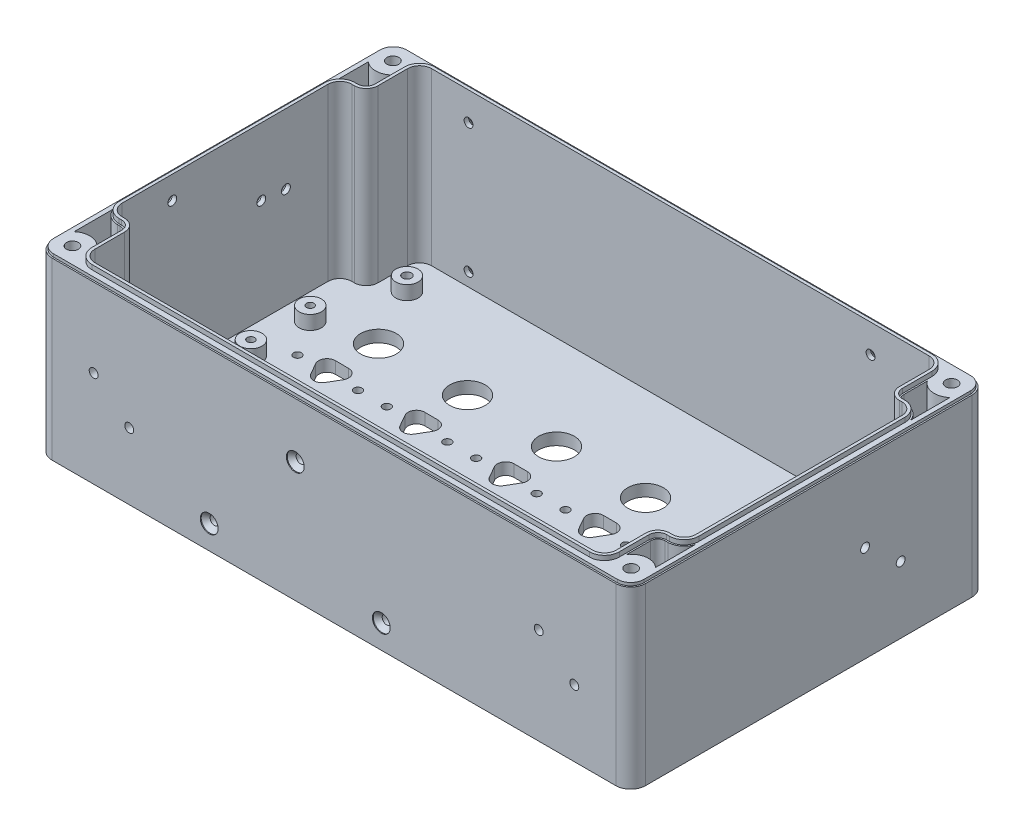
from build123d import *

# Parameters (mm, degrees)
SKETCH1_W                                         = 200
SKETCH1_H                                         = 120
BOSS_EXTRUDE1_DEPTH                               = 60
FILLET1_R                                         = 5
SKETCH2_W                                         = 175.7
SKETCH2_H                                         = 18
SKETCH2_H_2                                       = 77.4
SKETCH2_W_2                                       = 8.85
SKETCH2_R                                         = 2
CUT_EXTRUDE1_DEPTH                                = 56
FILLET2_R                                         = 4
BOSS_EXTRUDE2_DEPTH                               = 1.55
CUT_EXTRUDE2_REACH                                = 132.046
SKETCH4_R                                         = 2
SKETCH5_R                                         = 3.45
CUT_EXTRUDE3_DEPTH                                = 52
CUT_EXTRUDE4_DEPTH                                = 56
CUT_EXTRUDE5_REACH                                = 133.865
SKETCH7_R                                         = 2.225
SKETCH8_R                                         = 3.75
SKETCH8_R_2                                       = 1.5
SKETCH8_R_3                                       = 1.25
BOSS_EXTRUDE3_DEPTH                               = 4.7
CUT_EXTRUDE6_DEPTH                                = 1
CUT_EXTRUDE7_START                                = -4.7
SKETCH10_R                                        = 3.75
CUT_EXTRUDE7_DEPTH                                = 4.7
CUT_EXTRUDE8_REACH                                = 169.894
SKETCH11_R                                        = 1.5
CSK_FOR_M3_FLAT_HEAD_MACHINE_SCREW1_AT_2_COUNT    = 2
CSK_FOR_M3_FLAT_HEAD_MACHINE_SCREW1_AT_2_PITCH    = 43.49999936
CSK_FOR_M3_FLAT_HEAD_MACHINE_SCREW1_AT_3_COUNT    = 2
CSK_FOR_M3_FLAT_HEAD_MACHINE_SCREW1_AT_3_PITCH    = 142.311279088
CSK_FOR_M3_FLAT_HEAD_MACHINE_SCREW1_AT_4_COUNT    = 2
CSK_FOR_M3_FLAT_HEAD_MACHINE_SCREW1_AT_4_PITCH    = 135.50000078
CUT_EXTRUDE9_REACH                                = 219.689
SKETCH15_R                                        = 1.5
CSK_FOR_M3_FLAT_HEAD_MACHINE_SCREW2_AT_2_COUNT    = 2
CSK_FOR_M3_FLAT_HEAD_MACHINE_SCREW2_AT_2_PITCH    = 8.338465087
CSK_FOR_M3_FLAT_HEAD_MACHINE_SCREW2_AT_3_COUNT    = 2
CSK_FOR_M3_FLAT_HEAD_MACHINE_SCREW2_AT_3_PITCH    = 41.431027021
CSK_FOR_M3_FLAT_HEAD_MACHINE_SCREW2_AT_4_COUNT    = 2
CSK_FOR_M3_FLAT_HEAD_MACHINE_SCREW2_AT_4_PITCH    = 46.065171225
CUT_EXTRUDE10_REACH                               = 169.894
SKETCH20_R                                        = 1.5
CUT_EXTRUDE11_REACH                               = 219.689
SKETCH21_R                                        = 1.5
CUT_EXTRUDE12_REACH                               = 133.865
SKETCH23_R                                        = 6
SKETCH23_R_2                                      = 1.35
FILLET3_R                                         = 1
CUT_EXTRUDE13_START                               = -4
CUT_EXTRUDE13_OUTLINE_R                           = 1.35
CUT_EXTRUDE13_DEPTH                               = 4
CUT_EXTRUDE15_REACH                               = 169.894
SKETCH28_R                                        = 1.5
CUT_EXTRUDE16_REACH                               = 133.865
SKETCH31_R                                        = 1.6
CSK_FOR_M2_5_FLAT_HEAD_MACHINE_SCREW1_AT_COUNT    = 2
CSK_FOR_M2_5_FLAT_HEAD_MACHINE_SCREW1_AT_PITCH    = 20.5
CSK_FOR_M2_5_FLAT_HEAD_MACHINE_SCREW_2_COUNT      = 2
CSK_FOR_M2_5_FLAT_HEAD_MACHINE_SCREW_2_PITCH      = 30.111126102
CSK_FOR_M2_5_FLAT_HEAD_MACHINE_SCREW_3_COUNT      = 2
CSK_FOR_M2_5_FLAT_HEAD_MACHINE_SCREW_3_PITCH      = 50.610915095
CSK_FOR_M2_5_FLAT_HEAD_MACHINE_SCREW_4_COUNT      = 2
CSK_FOR_M2_5_FLAT_HEAD_MACHINE_SCREW_4_PITCH      = 60.222252203
CSK_FOR_M2_5_FLAT_HEAD_MACHINE_SCREW_5_COUNT      = 2
CSK_FOR_M2_5_FLAT_HEAD_MACHINE_SCREW_5_PITCH      = 80.72198761
CSK_FOR_M2_5_FLAT_HEAD_MACHINE_SCREW_6_COUNT      = 2
CSK_FOR_M2_5_FLAT_HEAD_MACHINE_SCREW_6_PITCH      = 90.333378305
CSK_FOR_M2_5_FLAT_HEAD_MACHINE_SCREW_7_COUNT      = 2
CSK_FOR_M2_5_FLAT_HEAD_MACHINE_SCREW_7_PITCH      = 110.833089242
CSK_FOR_M2_5_FLAT_HEAD_MACHINE_SCREW_8_COUNT      = 2
CSK_FOR_M2_5_FLAT_HEAD_MACHINE_SCREW_8_PITCH      = 126.831152763
CSK_FOR_M2_5_FLAT_HEAD_MACHINE_SCREW_9_COUNT      = 2
CSK_FOR_M2_5_FLAT_HEAD_MACHINE_SCREW_9_PITCH      = 125.355382157
CUT_EXTRUDE17_REACH                               = 133.865
SKETCH34_R                                        = 1.6
SKETCH34_R_2                                      = 14
CSK_FOR_M3_FLAT_HEAD_MACHINE_SCREW3_AT_2_COUNT    = 2
CSK_FOR_M3_FLAT_HEAD_MACHINE_SCREW3_AT_2_PITCH    = 43.55743335
CSK_FOR_M3_FLAT_HEAD_MACHINE_SCREW3_AT_3_COUNT    = 2
CSK_FOR_M3_FLAT_HEAD_MACHINE_SCREW3_AT_3_PITCH    = 58
CSK_FOR_M3_FLAT_HEAD_MACHINE_SCREW4_AT_2_COUNT    = 2
CSK_FOR_M3_FLAT_HEAD_MACHINE_SCREW4_AT_2_PITCH    = 26
CSK_FOR_M3_FLAT_HEAD_MACHINE_SCREW4_AT_3_COUNT    = 2
CSK_FOR_M3_FLAT_HEAD_MACHINE_SCREW4_AT_3_PITCH    = 66
CSK_FOR_M3_FLAT_HEAD_MACHINE_SCREW4_AT_4_COUNT    = 2
CSK_FOR_M3_FLAT_HEAD_MACHINE_SCREW4_AT_4_PITCH    = 70.936591404
CUT_EXTRUDE18_REACH                               = 133.865
SKETCH35_R                                        = 1.35
CSK_FOR_M2_5_FLAT_HEAD_MACHINE_SCREW2_D           = 2.5
CSK_FOR_M2_5_FLAT_HEAD_MACHINE_SCREW2_DEPTH       = 3.999
CSK_FOR_M2_5_FLAT_HEAD_MACHINE_SCREW2_CSINK_D     = 5
CSK_FOR_M2_5_FLAT_HEAD_MACHINE_SCREW2_CSINK_ANGLE = 90
CSK_FOR_M2_5_FLAT_HEAD_MACHINE_SCREW2_TIP         = 0.751075774


# Read off the part's stored shape, not the designer's step: Cut-Extrude13
with BuildPart() as part:
    # Sketch1 → Boss-Extrude1 (new body)
    with BuildSketch(Plane(origin=(0, 0, 0), x_dir=(1, 0, 0), z_dir=(0, 1, 0))):
        Rectangle(SKETCH1_W, SKETCH1_H)
    extrude(amount=BOSS_EXTRUDE1_DEPTH)

    # Fillet1
    fillet1_edges = [part.edges().sort_by_distance(p)[0] for p in [
        (100, 30, 60),
        (-100, 30, 60),
        (-100, 30, -60),
        (100, 30, -60),
    ]]
    fillet(fillet1_edges, radius=FILLET1_R)

    # Sketch2 → Cut-Extrude1 (cut)
    with BuildSketch(Plane(origin=(0, 60, 0), x_dir=(1, 0, 0), z_dir=(0, 1, 0))):
        with Locations((0, 47.7)):
            Rectangle(SKETCH2_W, SKETCH2_H)
        Rectangle(SKETCH2_W, SKETCH2_H_2)
        with Locations((0, -47.7)):
            Rectangle(SKETCH2_W, SKETCH2_H)
        with Locations((-92.275, 0)):
            Rectangle(SKETCH2_W_2, SKETCH2_H_2)
        with Locations((92.275, 0)):
            Rectangle(SKETCH2_W_2, SKETCH2_H_2)
        with Locations(Location((-94.15, 54, 0), (0, 0, 270))):
            Circle(SKETCH2_R)
        with Locations(Location((-94.15, -54, 0), (0, 0, 270))):
            Circle(SKETCH2_R)
        with Locations(Location((94.15, 54, 0), (0, 0, 270))):
            Circle(SKETCH2_R)
        with Locations(Location((94.15, -54, 0), (0, 0, 270))):
            Circle(SKETCH2_R)
    extrude(amount=-CUT_EXTRUDE1_DEPTH, mode=Mode.SUBTRACT)

    # Fillet2
    fillet2_edges = [part.edges().sort_by_distance(p)[0] for p in [
        (-87.85, 32, -38.7),
        (-87.85, 32, -56.7),
        (87.85, 32, -56.7),
        (87.85, 32, -38.7),
        (96.7, 32, -38.7),
        (96.7, 32, 38.7),
        (87.85, 32, 38.7),
        (87.85, 32, 56.7),
        (-87.85, 32, 56.7),
        (-87.85, 32, 38.7),
        (-96.7, 32, 38.7),
        (-96.7, 32, -38.7),
    ]]
    fillet(fillet2_edges, radius=FILLET2_R)

    # Sketch3 → Boss-Extrude2 (add)
    with BuildSketch(Plane(origin=(0, 60, 0), x_dir=(1, 0, 0), z_dir=(0, 1, 0))):
        with BuildLine():
            Line((83.85, 57.7), (-83.85, 57.7))
            ThreePointArc((-83.85, 57.7), (-87.385533906, 56.235533906), (-88.85, 52.7))
            Line((-88.85, 52.7), (-88.85, 42.7))
            ThreePointArc((-88.85, 42.7), (-89.728679656, 40.578679656), (-91.85, 39.7))
            Line((-91.85, 39.7), (-92.7, 39.7))
            ThreePointArc((-92.7, 39.7), (-96.235533906, 38.235533906), (-97.7, 34.7))
            Line((-97.7, 34.7), (-97.7, -34.7))
            ThreePointArc((-97.7, -34.7), (-96.235533906, -38.235533906), (-92.7, -39.7))
            Line((-92.7, -39.7), (-91.85, -39.7))
            ThreePointArc((-91.85, -39.7), (-89.728679656, -40.578679656), (-88.85, -42.7))
            Line((-88.85, -42.7), (-88.85, -52.7))
            ThreePointArc((-88.85, -52.7), (-87.385533906, -56.235533906), (-83.85, -57.7))
            Line((-83.85, -57.7), (83.85, -57.7))
            ThreePointArc((83.85, -57.7), (87.385533906, -56.235533906), (88.85, -52.7))
            Line((88.85, -52.7), (88.85, -42.7))
            ThreePointArc((88.85, -42.7), (89.728679656, -40.578679656), (91.85, -39.7))
            Line((91.85, -39.7), (92.7, -39.7))
            ThreePointArc((92.7, -39.7), (96.235533906, -38.235533906), (97.7, -34.7))
            Line((97.7, -34.7), (97.7, 34.7))
            ThreePointArc((97.7, 34.7), (96.235533906, 38.235533906), (92.7, 39.7))
            Line((92.7, 39.7), (91.85, 39.7))
            ThreePointArc((91.85, 39.7), (89.728679656, 40.578679656), (88.85, 42.7))
            Line((88.85, 42.7), (88.85, 52.7))
            ThreePointArc((88.85, 52.7), (87.385533906, 56.235533906), (83.85, 57.7))
        make_face()
        with BuildLine():
            Line((87.85, 42.7), (87.85, 52.7))
            ThreePointArc((87.85, 52.7), (86.678427125, 55.528427125), (83.85, 56.7))
            Line((83.85, 56.7), (-83.85, 56.7))
            ThreePointArc((-83.85, 56.7), (-86.678427125, 55.528427125), (-87.85, 52.7))
            Line((-87.85, 52.7), (-87.85, 42.7))
            ThreePointArc((-87.85, 42.7), (-89.021572875, 39.871572875), (-91.85, 38.7))
            Line((-91.85, 38.7), (-92.7, 38.7))
            ThreePointArc((-92.7, 38.7), (-95.528427125, 37.528427125), (-96.7, 34.7))
            Line((-96.7, 34.7), (-96.7, -34.7))
            ThreePointArc((-96.7, -34.7), (-95.528427125, -37.528427125), (-92.7, -38.7))
            Line((-92.7, -38.7), (-91.85, -38.7))
            ThreePointArc((-91.85, -38.7), (-89.021572875, -39.871572875), (-87.85, -42.7))
            Line((-87.85, -42.7), (-87.85, -52.7))
            ThreePointArc((-87.85, -52.7), (-86.678427125, -55.528427125), (-83.85, -56.7))
            Line((-83.85, -56.7), (83.85, -56.7))
            ThreePointArc((83.85, -56.7), (86.678427125, -55.528427125), (87.85, -52.7))
            Line((87.85, -52.7), (87.85, -42.7))
            ThreePointArc((87.85, -42.7), (89.021572875, -39.871572875), (91.85, -38.7))
            Line((91.85, -38.7), (92.7, -38.7))
            ThreePointArc((92.7, -38.7), (95.528427125, -37.528427125), (96.7, -34.7))
            Line((96.7, -34.7), (96.7, 34.7))
            ThreePointArc((96.7, 34.7), (95.528427125, 37.528427125), (92.7, 38.7))
            Line((92.7, 38.7), (91.85, 38.7))
            ThreePointArc((91.85, 38.7), (89.021572875, 39.871572875), (87.85, 42.7))
        make_face(mode=Mode.SUBTRACT)
    extrude(amount=BOSS_EXTRUDE2_DEPTH)

    # Sketch4 → Cut-Extrude2 (cut, up to next)
    with BuildSketch(Plane(origin=(0, 4, 0), x_dir=(1, 0, 0), z_dir=(0, 1, 0)), mode=Mode.PRIVATE) as cut_extrude2_sk1:
        with Locations(Location((-94.15, 54, 0), (0, 0, 270))):
            Circle(SKETCH4_R)
    cut_extrude2_tool1 = extrude(cut_extrude2_sk1.sketch, amount=-CUT_EXTRUDE2_REACH, mode=Mode.PRIVATE) & part.part
    # Sketch4 → Cut-Extrude2 (cut, up to next)
    with BuildSketch(Plane(origin=(0, 4, 0), x_dir=(1, 0, 0), z_dir=(0, 1, 0)), mode=Mode.PRIVATE) as cut_extrude2_sk2:
        with Locations(Location((94.15, 54, 0), (0, 0, 270))):
            Circle(SKETCH4_R)
    cut_extrude2_tool2 = extrude(cut_extrude2_sk2.sketch, amount=-CUT_EXTRUDE2_REACH, mode=Mode.PRIVATE) & part.part
    # Sketch4 → Cut-Extrude2 (cut, up to next)
    with BuildSketch(Plane(origin=(0, 4, 0), x_dir=(1, 0, 0), z_dir=(0, 1, 0)), mode=Mode.PRIVATE) as cut_extrude2_sk3:
        with Locations(Location((-94.15, -54, 0), (0, 0, 270))):
            Circle(SKETCH4_R)
    cut_extrude2_tool3 = extrude(cut_extrude2_sk3.sketch, amount=-CUT_EXTRUDE2_REACH, mode=Mode.PRIVATE) & part.part
    # Sketch4 → Cut-Extrude2 (cut, up to next)
    with BuildSketch(Plane(origin=(0, 4, 0), x_dir=(1, 0, 0), z_dir=(0, 1, 0)), mode=Mode.PRIVATE) as cut_extrude2_sk4:
        with Locations(Location((94.15, -54, 0), (0, 0, 270))):
            Circle(SKETCH4_R)
    cut_extrude2_tool4 = extrude(cut_extrude2_sk4.sketch, amount=-CUT_EXTRUDE2_REACH, mode=Mode.PRIVATE) & part.part
    add(cut_extrude2_tool1.solids().sort_by_distance((-94.15, 4, -54))[0], mode=Mode.SUBTRACT)
    add(cut_extrude2_tool2.solids().sort_by_distance((94.15, 4, -54))[0], mode=Mode.SUBTRACT)
    add(cut_extrude2_tool3.solids().sort_by_distance((-94.15, 4, 54))[0], mode=Mode.SUBTRACT)
    add(cut_extrude2_tool4.solids().sort_by_distance((94.15, 4, 54))[0], mode=Mode.SUBTRACT)

    # Sketch5 → Cut-Extrude3 (cut)
    with BuildSketch(Plane.XZ):
        with Locations(Location((-94.15, 54, 0), (0, 0, 270))):
            Circle(SKETCH5_R)
        with Locations(Location((94.15, 54, 0), (0, 0, 270))):
            Circle(SKETCH5_R)
        with Locations(Location((94.15, -54, 0), (0, 0, 270))):
            Circle(SKETCH5_R)
        with Locations(Location((-94.15, -54, 0), (0, 0, 270))):
            Circle(SKETCH5_R)
    extrude(amount=-CUT_EXTRUDE3_DEPTH, mode=Mode.SUBTRACT)

    # Sketch6 → Cut-Extrude4 (cut)
    with BuildSketch(Plane(origin=(0, 60, 0), x_dir=(1, 0, 0), z_dir=(0, 1, 0))):
        with BuildLine():
            ThreePointArc((-89.35, 50.655975479), (-93.438101188, 48.193477798), (-98, 49.595456891))
            Line((-98, 49.595456891), (-98, 36.169693846))
            ThreePointArc((-98, 36.169693846), (-96.02916535, 39.077974198), (-92.7, 40.2))
            Line((-92.7, 40.2), (-91.85, 40.2))
            ThreePointArc((-91.85, 40.2), (-90.082233047, 40.932233047), (-89.35, 42.7))
            Line((-89.35, 42.7), (-89.35, 50.655975479))
        make_face()
        with BuildLine():
            Line((98, 36.169693846), (98, 49.595456891))
            ThreePointArc((98, 49.595456891), (93.438101188, 48.193477798), (89.35, 50.655975479))
            Line((89.35, 50.655975479), (89.35, 42.7))
            ThreePointArc((89.35, 42.7), (90.082233047, 40.932233047), (91.85, 40.2))
            Line((91.85, 40.2), (92.7, 40.2))
            ThreePointArc((92.7, 40.2), (96.02916535, 39.077974198), (98, 36.169693846))
        make_face()
        with BuildLine():
            Line((98, -49.595456891), (98, -36.169693846))
            ThreePointArc((98, -36.169693846), (96.02916535, -39.077974198), (92.7, -40.2))
            Line((92.7, -40.2), (91.85, -40.2))
            ThreePointArc((91.85, -40.2), (90.082233047, -40.932233047), (89.35, -42.7))
            Line((89.35, -42.7), (89.35, -50.655975479))
            ThreePointArc((89.35, -50.655975479), (93.438101188, -48.193477798), (98, -49.595456891))
        make_face()
        with BuildLine():
            ThreePointArc((-92.7, -40.2), (-96.02916535, -39.077974198), (-98, -36.169693846))
            Line((-98, -36.169693846), (-98, -49.595456891))
            ThreePointArc((-98, -49.595456891), (-93.438101188, -48.193477798), (-89.35, -50.655975479))
            Line((-89.35, -50.655975479), (-89.35, -42.7))
            ThreePointArc((-89.35, -42.7), (-90.082233047, -40.932233047), (-91.85, -40.2))
            Line((-91.85, -40.2), (-92.7, -40.2))
        make_face()
    extrude(amount=-CUT_EXTRUDE4_DEPTH, mode=Mode.SUBTRACT)

    # Sketch7 → Cut-Extrude5 (cut, up to next)
    with BuildSketch(Plane.XZ, mode=Mode.PRIVATE) as cut_extrude5_sk1:
        with Locations(Location((-94.15, 45, 0), (0, 0, 270))):
            Circle(SKETCH7_R)
    cut_extrude5_tool1 = extrude(cut_extrude5_sk1.sketch, amount=-CUT_EXTRUDE5_REACH, mode=Mode.PRIVATE) & part.part
    # Sketch7 → Cut-Extrude5 (cut, up to next)
    with BuildSketch(Plane.XZ, mode=Mode.PRIVATE) as cut_extrude5_sk2:
        with Locations(Location((94.15, 45, 0), (0, 0, 270))):
            Circle(SKETCH7_R)
    cut_extrude5_tool2 = extrude(cut_extrude5_sk2.sketch, amount=-CUT_EXTRUDE5_REACH, mode=Mode.PRIVATE) & part.part
    # Sketch7 → Cut-Extrude5 (cut, up to next)
    with BuildSketch(Plane.XZ, mode=Mode.PRIVATE) as cut_extrude5_sk3:
        with Locations(Location((94.15, -45, 0), (0, 0, 270))):
            Circle(SKETCH7_R)
    cut_extrude5_tool3 = extrude(cut_extrude5_sk3.sketch, amount=-CUT_EXTRUDE5_REACH, mode=Mode.PRIVATE) & part.part
    # Sketch7 → Cut-Extrude5 (cut, up to next)
    with BuildSketch(Plane.XZ, mode=Mode.PRIVATE) as cut_extrude5_sk4:
        with Locations(Location((-94.15, -45, 0), (0, 0, 270))):
            Circle(SKETCH7_R)
    cut_extrude5_tool4 = extrude(cut_extrude5_sk4.sketch, amount=-CUT_EXTRUDE5_REACH, mode=Mode.PRIVATE) & part.part
    add(cut_extrude5_tool1.solids().sort_by_distance((-94.15, 0, 45))[0], mode=Mode.SUBTRACT)
    add(cut_extrude5_tool2.solids().sort_by_distance((94.15, 0, 45))[0], mode=Mode.SUBTRACT)
    add(cut_extrude5_tool3.solids().sort_by_distance((94.15, 0, -45))[0], mode=Mode.SUBTRACT)
    add(cut_extrude5_tool4.solids().sort_by_distance((-94.15, 0, -45))[0], mode=Mode.SUBTRACT)

    # Sketch8 → Boss-Extrude3 (add)
    # profile 1 of 12: a face of its own
    with BuildSketch(Plane(origin=(0, 4, 0), x_dir=(1, 0, 0), z_dir=(0, 1, 0))):
        with Locations(Location((-80.4, 45, 0), (0, 0, 270))):
            Circle(SKETCH8_R)
        with Locations(Location((-80.4, 45, 0), (0, 0, 270))):
            Circle(SKETCH8_R_2, mode=Mode.SUBTRACT)
    # profile 2 of 12: a face of its own
    with BuildSketch(Plane(origin=(0, 4, 0), x_dir=(1, 0, 0), z_dir=(0, 1, 0))):
        with Locations(Location((80.4, 45, 0), (0, 0, 90))):
            Circle(SKETCH8_R)
        with Locations(Location((80.4, 45, 0), (0, 0, 90))):
            Circle(SKETCH8_R_2, mode=Mode.SUBTRACT)
    # profile 3 of 12: a face of its own
    with BuildSketch(Plane(origin=(0, 4, 0), x_dir=(1, 0, 0), z_dir=(0, 1, 0))):
        with Locations(Location((80.4, -45, 0), (0, 0, 270))):
            Circle(SKETCH8_R)
        with Locations(Location((80.4, -45, 0), (0, 0, 270))):
            Circle(SKETCH8_R_2, mode=Mode.SUBTRACT)
    # profile 4 of 12: a face of its own
    with BuildSketch(Plane(origin=(0, 4, 0), x_dir=(1, 0, 0), z_dir=(0, 1, 0))):
        with Locations(Location((-80.4, -45, 0), (0, 0, 90))):
            Circle(SKETCH8_R)
        with Locations(Location((-80.4, -45, 0), (0, 0, 90))):
            Circle(SKETCH8_R_2, mode=Mode.SUBTRACT)
    # profile 5 of 12: a face of its own
    with BuildSketch(Plane(origin=(0, 4, 0), x_dir=(1, 0, 0), z_dir=(0, 1, 0))):
        with Locations(Location((-57.9, 45, 0), (0, 0, 270))):
            Circle(SKETCH8_R)
        with Locations(Location((-57.9, 45, 0), (0, 0, 270))):
            Circle(SKETCH8_R_3, mode=Mode.SUBTRACT)
    # profile 6 of 12: a face of its own
    with BuildSketch(Plane(origin=(0, 4, 0), x_dir=(1, 0, 0), z_dir=(0, 1, 0))):
        with Locations(Location((-57.9, -45, 0), (0, 0, 90))):
            Circle(SKETCH8_R)
        with Locations(Location((-57.9, -45, 0), (0, 0, 90))):
            Circle(SKETCH8_R_3, mode=Mode.SUBTRACT)
    # profile 7 of 12: a face of its own
    with BuildSketch(Plane(origin=(0, 4, 0), x_dir=(1, 0, 0), z_dir=(0, 1, 0))):
        with Locations(Location((-88, 0, 0), (0, 0, 270))):
            Circle(SKETCH8_R)
        with Locations(Location((-88, 0, 0), (0, 0, 270))):
            Circle(SKETCH8_R_3, mode=Mode.SUBTRACT)
    # profile 8 of 12: a face of its own
    with BuildSketch(Plane(origin=(0, 4, 0), x_dir=(1, 0, 0), z_dir=(0, 1, 0))):
        with Locations(Location((-88, 20, 0), (0, 0, 270))):
            Circle(SKETCH8_R)
        with Locations(Location((-88, 20, 0), (0, 0, 270))):
            Circle(SKETCH8_R_3, mode=Mode.SUBTRACT)
    # profile 9 of 12: a face of its own
    with BuildSketch(Plane(origin=(0, 4, 0), x_dir=(1, 0, 0), z_dir=(0, 1, 0))):
        with Locations(Location((-88, -20, 0), (0, 0, 90))):
            Circle(SKETCH8_R)
        with Locations(Location((-88, -20, 0), (0, 0, 90))):
            Circle(SKETCH8_R_3, mode=Mode.SUBTRACT)
    # profile 10 of 12: a face of its own
    with BuildSketch(Plane(origin=(0, 4, 0), x_dir=(1, 0, 0), z_dir=(0, 1, 0))):
        with Locations(Location((88, -20, 0), (0, 0, 270))):
            Circle(SKETCH8_R)
        with Locations(Location((88, -20, 0), (0, 0, 270))):
            Circle(SKETCH8_R_3, mode=Mode.SUBTRACT)
    # profile 11 of 12: a face of its own
    with BuildSketch(Plane(origin=(0, 4, 0), x_dir=(1, 0, 0), z_dir=(0, 1, 0))):
        with Locations(Location((88, 0, 0), (0, 0, 90))):
            Circle(SKETCH8_R)
        with Locations(Location((88, 0, 0), (0, 0, 90))):
            Circle(SKETCH8_R_3, mode=Mode.SUBTRACT)
    # profile 12 of 12: a face of its own
    with BuildSketch(Plane(origin=(0, 4, 0), x_dir=(1, 0, 0), z_dir=(0, 1, 0))):
        with Locations(Location((88, 20, 0), (0, 0, 90))):
            Circle(SKETCH8_R)
        with Locations(Location((88, 20, 0), (0, 0, 90))):
            Circle(SKETCH8_R_3, mode=Mode.SUBTRACT)
    extrude(amount=BOSS_EXTRUDE3_DEPTH)

    # Sketch9 → Cut-Extrude6 (cut)
    with BuildSketch(Plane(origin=(0, 60, 0), x_dir=(1, 0, 0), z_dir=(0, 1, 0))):
        with BuildLine():
            Line((95, 60), (-95, 60))
            ThreePointArc((-95, 60), (-98.535533906, 58.535533906), (-100, 55))
            Line((-100, 55), (-100, -55))
            ThreePointArc((-100, -55), (-98.535533906, -58.535533906), (-95, -60))
            Line((-95, -60), (95, -60))
            ThreePointArc((95, -60), (98.535533906, -58.535533906), (100, -55))
            Line((100, -55), (100, 55))
            ThreePointArc((100, 55), (98.535533906, 58.535533906), (95, 60))
        make_face()
        with BuildLine():
            Line((95, 59.5), (-95, 59.5))
            ThreePointArc((-95, 59.5), (-98.181980515, 58.181980515), (-99.5, 55))
            Line((-99.5, 55), (-99.5, -55))
            ThreePointArc((-99.5, -55), (-98.181980515, -58.181980515), (-95, -59.5))
            Line((-95, -59.5), (95, -59.5))
            ThreePointArc((95, -59.5), (98.181980515, -58.181980515), (99.5, -55))
            Line((99.5, -55), (99.5, 55))
            ThreePointArc((99.5, 55), (98.181980515, 58.181980515), (95, 59.5))
        make_face(mode=Mode.SUBTRACT)
    extrude(amount=-CUT_EXTRUDE6_DEPTH, mode=Mode.SUBTRACT)

    # Sketch10 → Cut-Extrude7 (cut)
    with BuildSketch(Plane(origin=(0, 8.7, 0), x_dir=(1, 0, 0), z_dir=(0, 1, 0)).offset(CUT_EXTRUDE7_START)):
        with Locations((-57.9, 45)):
            Circle(SKETCH10_R)
    extrude(amount=CUT_EXTRUDE7_DEPTH, mode=Mode.SUBTRACT)

    # Sketch11 → Cut-Extrude8 (cut, up to next)
    with BuildSketch(Plane(origin=(0, 0, -60), x_dir=(-1, 0, 0), z_dir=(0, 0, -1)), mode=Mode.PRIVATE) as cut_extrude8_sk1:
        with Locations((71.349994695, 51.99999699)):
            Circle(SKETCH11_R)
    cut_extrude8_tool1 = extrude(cut_extrude8_sk1.sketch, amount=-CUT_EXTRUDE8_REACH, mode=Mode.PRIVATE) & part.part
    # Sketch11 → Cut-Extrude8 (cut, up to next)
    with BuildSketch(Plane(origin=(0, 0, -60), x_dir=(-1, 0, 0), z_dir=(0, 0, -1)), mode=Mode.PRIVATE) as cut_extrude8_sk2:
        with Locations((-64.150006085, 52.00000189)):
            Circle(SKETCH11_R)
    cut_extrude8_tool2 = extrude(cut_extrude8_sk2.sketch, amount=-CUT_EXTRUDE8_REACH, mode=Mode.PRIVATE) & part.part
    # Sketch11 → Cut-Extrude8 (cut, up to next)
    with BuildSketch(Plane(origin=(0, 0, -60), x_dir=(-1, 0, 0), z_dir=(0, 0, -1)), mode=Mode.PRIVATE) as cut_extrude8_sk3:
        with Locations((-64.150007657, 8.50000253)):
            Circle(SKETCH11_R)
    cut_extrude8_tool3 = extrude(cut_extrude8_sk3.sketch, amount=-CUT_EXTRUDE8_REACH, mode=Mode.PRIVATE) & part.part
    # Sketch11 → Cut-Extrude8 (cut, up to next)
    with BuildSketch(Plane(origin=(0, 0, -60), x_dir=(-1, 0, 0), z_dir=(0, 0, -1)), mode=Mode.PRIVATE) as cut_extrude8_sk4:
        with Locations((71.349993123, 8.49999763)):
            Circle(SKETCH11_R)
    cut_extrude8_tool4 = extrude(cut_extrude8_sk4.sketch, amount=-CUT_EXTRUDE8_REACH, mode=Mode.PRIVATE) & part.part
    add(cut_extrude8_tool1.solids().sort_by_distance((-71.349995, 51.999997, -60))[0], mode=Mode.SUBTRACT)
    add(cut_extrude8_tool2.solids().sort_by_distance((64.150006, 52.000002, -60))[0], mode=Mode.SUBTRACT)
    add(cut_extrude8_tool3.solids().sort_by_distance((64.150008, 8.500003, -60))[0], mode=Mode.SUBTRACT)
    add(cut_extrude8_tool4.solids().sort_by_distance((-71.349993, 8.499998, -60))[0], mode=Mode.SUBTRACT)

    # Sketch14 → CSK for M3 Flat Head Machine Screw1 (revolve, cut)
    with BuildSketch(Plane(origin=(-71.349994695, 51.99999699, -60), x_dir=(0, 1, 0), z_dir=(1, 0, 0))):
        Polygon((0, 0), (0, 4.200290929), (1.5, 3.299), (1.5, 1.8), (3, 0.3), (3, 0), align=None)
    csk_for_m3_flat_head_machine_screw1 = revolve(axis=Axis((-71.349994695, 51.99999699, -66.35), (0, 0, 1)), mode=Mode.SUBTRACT)

    # CSK for M3 Flat Head Machine Screw1 at 2: CSK for M3 Flat Head Machine Screw1 ×2
    with Locations(*[(0, -i * CSK_FOR_M3_FLAT_HEAD_MACHINE_SCREW1_AT_2_PITCH, 0) for i in range(1, CSK_FOR_M3_FLAT_HEAD_MACHINE_SCREW1_AT_2_COUNT)]):
        add(csk_for_m3_flat_head_machine_screw1, mode=Mode.SUBTRACT)

    # CSK for M3 Flat Head Machine Screw1 at 3: CSK for M3 Flat Head Machine Screw1 ×2
    with Locations(*[Vector(0.9521381806209335, -0.3056679325736653, 0) * (i * CSK_FOR_M3_FLAT_HEAD_MACHINE_SCREW1_AT_3_PITCH) for i in range(1, CSK_FOR_M3_FLAT_HEAD_MACHINE_SCREW1_AT_3_COUNT)]):
        add(csk_for_m3_flat_head_machine_screw1, mode=Mode.SUBTRACT)

    # CSK for M3 Flat Head Machine Screw1 at 4: CSK for M3 Flat Head Machine Screw1 ×2
    with Locations(*[(i * CSK_FOR_M3_FLAT_HEAD_MACHINE_SCREW1_AT_4_PITCH, 0, 0) for i in range(1, CSK_FOR_M3_FLAT_HEAD_MACHINE_SCREW1_AT_4_COUNT)]):
        add(csk_for_m3_flat_head_machine_screw1, mode=Mode.SUBTRACT)

    # Sketch15 → Cut-Extrude9 (cut, up to next)
    with BuildSketch(Plane.ZY.offset(100), mode=Mode.PRIVATE) as cut_extrude9_sk1:
        with Locations((-20.5, 38.017186232)):
            Circle(SKETCH15_R)
    cut_extrude9_tool1 = extrude(cut_extrude9_sk1.sketch, amount=-CUT_EXTRUDE9_REACH, mode=Mode.PRIVATE) & part.part
    # Sketch15 → Cut-Extrude9 (cut, up to next)
    with BuildSketch(Plane.ZY.offset(100), mode=Mode.PRIVATE) as cut_extrude9_sk2:
        with Locations((-12.2, 38.817186232)):
            Circle(SKETCH15_R)
    cut_extrude9_tool2 = extrude(cut_extrude9_sk2.sketch, amount=-CUT_EXTRUDE9_REACH, mode=Mode.PRIVATE) & part.part
    # Sketch15 → Cut-Extrude9 (cut, up to next)
    with BuildSketch(Plane.ZY.offset(100), mode=Mode.PRIVATE) as cut_extrude9_sk3:
        with Locations((17.8, 53.817186232)):
            Circle(SKETCH15_R)
    cut_extrude9_tool3 = extrude(cut_extrude9_sk3.sketch, amount=-CUT_EXTRUDE9_REACH, mode=Mode.PRIVATE) & part.part
    # Sketch15 → Cut-Extrude9 (cut, up to next)
    with BuildSketch(Plane.ZY.offset(100), mode=Mode.PRIVATE) as cut_extrude9_sk4:
        with Locations((20.5, 17.017186232)):
            Circle(SKETCH15_R)
    cut_extrude9_tool4 = extrude(cut_extrude9_sk4.sketch, amount=-CUT_EXTRUDE9_REACH, mode=Mode.PRIVATE) & part.part
    add(cut_extrude9_tool1.solids().sort_by_distance((-100, 38.017186, -20.5))[0], mode=Mode.SUBTRACT)
    add(cut_extrude9_tool2.solids().sort_by_distance((-100, 38.817186, -12.2))[0], mode=Mode.SUBTRACT)
    add(cut_extrude9_tool3.solids().sort_by_distance((-100, 53.817186, 17.8))[0], mode=Mode.SUBTRACT)
    add(cut_extrude9_tool4.solids().sort_by_distance((-100, 17.017186, 20.5))[0], mode=Mode.SUBTRACT)

    # Sketch18 → CSK for M3 Flat Head Machine Screw2 (revolve, cut)
    with BuildSketch(Plane(origin=(-100, 38.017186232, -20.5), x_dir=(0, 0, 1), z_dir=(0, 1, 0))):
        Polygon((0, 0), (0, 4.200290929), (1.5, 3.299), (1.5, 1.8), (3, 0.3), (3, 0), align=None)
    csk_for_m3_flat_head_machine_screw2 = revolve(axis=Axis((-106.35, 38.017186232, -20.5), (1, 0, 0)), mode=Mode.SUBTRACT)

    # CSK for M3 Flat Head Machine Screw2 at 2: CSK for M3 Flat Head Machine Screw2 ×2
    with Locations(*[Vector(0, 0.09594091858563021, 0.9953870303258655) * (i * CSK_FOR_M3_FLAT_HEAD_MACHINE_SCREW2_AT_2_PITCH) for i in range(1, CSK_FOR_M3_FLAT_HEAD_MACHINE_SCREW2_AT_2_COUNT)]):
        add(csk_for_m3_flat_head_machine_screw2, mode=Mode.SUBTRACT)

    # CSK for M3 Flat Head Machine Screw2 at 3: CSK for M3 Flat Head Machine Screw2 ×2
    with Locations(*[Vector(0, 0.38135670622067125, 0.9244279650792271) * (i * CSK_FOR_M3_FLAT_HEAD_MACHINE_SCREW2_AT_3_PITCH) for i in range(1, CSK_FOR_M3_FLAT_HEAD_MACHINE_SCREW2_AT_3_COUNT)]):
        add(csk_for_m3_flat_head_machine_screw2, mode=Mode.SUBTRACT)

    # CSK for M3 Flat Head Machine Screw2 at 4: CSK for M3 Flat Head Machine Screw2 ×2
    with Locations(*[Vector(0, -0.45587586980566086, 0.8900433648586636) * (i * CSK_FOR_M3_FLAT_HEAD_MACHINE_SCREW2_AT_4_PITCH) for i in range(1, CSK_FOR_M3_FLAT_HEAD_MACHINE_SCREW2_AT_4_COUNT)]):
        add(csk_for_m3_flat_head_machine_screw2, mode=Mode.SUBTRACT)

    # Sketch20 → Cut-Extrude10 (cut, up to next)
    with BuildSketch(Plane.XY.offset(60), mode=Mode.PRIVATE) as cut_extrude10_sk1:
        with Locations((-81, 32.45)):
            Circle(SKETCH20_R)
    cut_extrude10_tool1 = extrude(cut_extrude10_sk1.sketch, amount=-CUT_EXTRUDE10_REACH, mode=Mode.PRIVATE) & part.part
    # Sketch20 → Cut-Extrude10 (cut, up to next)
    with BuildSketch(Plane.XY.offset(60), mode=Mode.PRIVATE) as cut_extrude10_sk2:
        with Locations((-69, 22.45)):
            Circle(SKETCH20_R)
    cut_extrude10_tool2 = extrude(cut_extrude10_sk2.sketch, amount=-CUT_EXTRUDE10_REACH, mode=Mode.PRIVATE) & part.part
    # Sketch20 → Cut-Extrude10 (cut, up to next)
    with BuildSketch(Plane.XY.offset(60), mode=Mode.PRIVATE) as cut_extrude10_sk3:
        with Locations((69, 32.45)):
            Circle(SKETCH20_R)
    cut_extrude10_tool3 = extrude(cut_extrude10_sk3.sketch, amount=-CUT_EXTRUDE10_REACH, mode=Mode.PRIVATE) & part.part
    # Sketch20 → Cut-Extrude10 (cut, up to next)
    with BuildSketch(Plane.XY.offset(60), mode=Mode.PRIVATE) as cut_extrude10_sk4:
        with Locations((81, 22.45)):
            Circle(SKETCH20_R)
    cut_extrude10_tool4 = extrude(cut_extrude10_sk4.sketch, amount=-CUT_EXTRUDE10_REACH, mode=Mode.PRIVATE) & part.part
    add(cut_extrude10_tool1.solids().sort_by_distance((-81, 32.45, 60))[0], mode=Mode.SUBTRACT)
    add(cut_extrude10_tool2.solids().sort_by_distance((-69, 22.45, 60))[0], mode=Mode.SUBTRACT)
    add(cut_extrude10_tool3.solids().sort_by_distance((69, 32.45, 60))[0], mode=Mode.SUBTRACT)
    add(cut_extrude10_tool4.solids().sort_by_distance((81, 22.45, 60))[0], mode=Mode.SUBTRACT)

    # Sketch21 → Cut-Extrude11 (cut, up to next)
    with BuildSketch(Plane(origin=(100, 0, 0), x_dir=(0, 0, -1), z_dir=(1, 0, 0)), mode=Mode.PRIVATE) as cut_extrude11_sk1:
        with Locations((31, 22.45)):
            Circle(SKETCH21_R)
    cut_extrude11_tool1 = extrude(cut_extrude11_sk1.sketch, amount=-CUT_EXTRUDE11_REACH, mode=Mode.PRIVATE) & part.part
    # Sketch21 → Cut-Extrude11 (cut, up to next)
    with BuildSketch(Plane(origin=(100, 0, 0), x_dir=(0, 0, -1), z_dir=(1, 0, 0)), mode=Mode.PRIVATE) as cut_extrude11_sk2:
        with Locations((19, 32.45)):
            Circle(SKETCH21_R)
    cut_extrude11_tool2 = extrude(cut_extrude11_sk2.sketch, amount=-CUT_EXTRUDE11_REACH, mode=Mode.PRIVATE) & part.part
    add(cut_extrude11_tool1.solids().sort_by_distance((100, 22.45, -31))[0], mode=Mode.SUBTRACT)
    add(cut_extrude11_tool2.solids().sort_by_distance((100, 32.45, -19))[0], mode=Mode.SUBTRACT)

    # Sketch23 → Cut-Extrude12 (cut, up to next)
    with BuildSketch(Plane.XZ, mode=Mode.PRIVATE) as cut_extrude12_sk1:
        with BuildLine():
            Line((46.1, -9.25), (43.9, -9.25))
            ThreePointArc((43.9, -9.25), (41.778679656, -10.128679656), (40.9, -12.25))
            Line((40.9, -12.25), (40.9, -25))
            Line((40.9, -25), (49.1, -25))
            Line((49.1, -25), (49.1, -12.25))
            ThreePointArc((49.1, -12.25), (48.221320344, -10.128679656), (46.1, -9.25))
        make_face()
    cut_extrude12_tool1 = extrude(cut_extrude12_sk1.sketch, amount=-CUT_EXTRUDE12_REACH, mode=Mode.PRIVATE) & part.part
    # Sketch23 → Cut-Extrude12 (cut, up to next)
    with BuildSketch(Plane.XZ, mode=Mode.PRIVATE) as cut_extrude12_sk2:
        with Locations(Location((-70, -25, 0), (0, 0, 270))):
            Circle(SKETCH23_R)
    cut_extrude12_tool2 = extrude(cut_extrude12_sk2.sketch, amount=-CUT_EXTRUDE12_REACH, mode=Mode.PRIVATE) & part.part
    # Sketch23 → Cut-Extrude12 (cut, up to next)
    with BuildSketch(Plane.XZ, mode=Mode.PRIVATE) as cut_extrude12_sk3:
        with Locations(Location((-40, -25, 0), (0, 0, 270))):
            Circle(SKETCH23_R)
    cut_extrude12_tool3 = extrude(cut_extrude12_sk3.sketch, amount=-CUT_EXTRUDE12_REACH, mode=Mode.PRIVATE) & part.part
    # Sketch23 → Cut-Extrude12 (cut, up to next)
    with BuildSketch(Plane.XZ, mode=Mode.PRIVATE) as cut_extrude12_sk4:
        with Locations(Location((-10, -25, 0), (0, 0, 270))):
            Circle(SKETCH23_R)
    cut_extrude12_tool4 = extrude(cut_extrude12_sk4.sketch, amount=-CUT_EXTRUDE12_REACH, mode=Mode.PRIVATE) & part.part
    # Sketch23 → Cut-Extrude12 (cut, up to next)
    with BuildSketch(Plane.XZ, mode=Mode.PRIVATE) as cut_extrude12_sk5:
        with Locations(Location((20, -25, 0), (0, 0, 270))):
            Circle(SKETCH23_R)
    cut_extrude12_tool5 = extrude(cut_extrude12_sk5.sketch, amount=-CUT_EXTRUDE12_REACH, mode=Mode.PRIVATE) & part.part
    # Sketch23 → Cut-Extrude12 (cut, up to next)
    with BuildSketch(Plane.XZ, mode=Mode.PRIVATE) as cut_extrude12_sk6:
        with Locations(Location((45, -6.875, 0), (0, 0, 270))):
            Circle(SKETCH23_R_2)
    cut_extrude12_tool6 = extrude(cut_extrude12_sk6.sketch, amount=-CUT_EXTRUDE12_REACH, mode=Mode.PRIVATE) & part.part
    # Sketch23 → Cut-Extrude12 (cut, up to next)
    with BuildSketch(Plane.XZ, mode=Mode.PRIVATE) as cut_extrude12_sk7:
        with Locations(Location((45, -27.375, 0), (0, 0, 90))):
            Circle(SKETCH23_R_2)
    cut_extrude12_tool7 = extrude(cut_extrude12_sk7.sketch, amount=-CUT_EXTRUDE12_REACH, mode=Mode.PRIVATE) & part.part
    add(cut_extrude12_tool1.solids().sort_by_distance((45, 0, -17.34714))[0], mode=Mode.SUBTRACT)
    add(cut_extrude12_tool2.solids().sort_by_distance((-70, 0, -25))[0], mode=Mode.SUBTRACT)
    add(cut_extrude12_tool3.solids().sort_by_distance((-40, 0, -25))[0], mode=Mode.SUBTRACT)
    add(cut_extrude12_tool4.solids().sort_by_distance((-10, 0, -25))[0], mode=Mode.SUBTRACT)
    add(cut_extrude12_tool5.solids().sort_by_distance((20, 0, -25))[0], mode=Mode.SUBTRACT)
    add(cut_extrude12_tool6.solids().sort_by_distance((45, 0, -6.875))[0], mode=Mode.SUBTRACT)
    add(cut_extrude12_tool7.solids().sort_by_distance((45, 0, -27.375))[0], mode=Mode.SUBTRACT)

    # Fillet3
    fillet3_edges = [part.edges().sort_by_distance(p)[0] for p in [
        (40.9, 2, -25),
        (49.1, 2, -25),
    ]]
    fillet(fillet3_edges, radius=FILLET3_R)

    # Cut-Extrude13 outline → Cut-Extrude13 (cut)
    with BuildSketch(Plane.XZ.offset(CUT_EXTRUDE13_START)):
        with Locations((-59.850251433, -7.927109571)):
            Circle(CUT_EXTRUDE13_OUTLINE_R)
        with Locations((-50.238770669, -8.04769572)):
            Circle(CUT_EXTRUDE13_OUTLINE_R)
        with Locations((-29.739125331, -7.927109571)):
            Circle(CUT_EXTRUDE13_OUTLINE_R)
        with Locations((-20.127644568, -8.04769572)):
            Circle(CUT_EXTRUDE13_OUTLINE_R)
        with BuildLine():
            Line((17.77973187, -4.717465132), (15.563427282, -8.60890241))
            ThreePointArc((15.563427282, -8.60890241), (15.584147729, -11.426864883), (18.039015672, -12.810687565))
            Line((18.039015672, -12.810687565), (22.48418345, -12.784539519))
            ThreePointArc((22.48418345, -12.784539519), (24.922601808, -11.371932799), (24.910169469, -8.553921573))
            Line((24.910169469, -8.553921573), (22.648238222, -4.688826859))
            ThreePointArc((22.648238222, -4.688826859), (20.205717889, -3.297729269), (17.77973187, -4.717465132))
        make_face()
        with Locations((30.483126872, -7.927109571)):
            Circle(CUT_EXTRUDE13_OUTLINE_R)
        with Locations((9.983481534, -8.04769572)):
            Circle(CUT_EXTRUDE13_OUTLINE_R)
        with Locations((0.37200077, -7.927109571)):
            Circle(CUT_EXTRUDE13_OUTLINE_R)
        with BuildLine():
            Line((-12.331394232, -4.717465132), (-14.547698819, -8.60890241))
            ThreePointArc((-14.547698819, -8.60890241), (-14.526978373, -11.426864883), (-12.072110429, -12.810687565))
            Line((-12.072110429, -12.810687565), (-7.626942652, -12.784539519))
            ThreePointArc((-7.626942652, -12.784539519), (-5.188524293, -11.3719328), (-5.200956633, -8.553921573))
            Line((-5.200956633, -8.553921573), (-7.462887879, -4.688826859))
            ThreePointArc((-7.462887879, -4.688826859), (-9.905408213, -3.297729269), (-12.331394232, -4.717465132))
        make_face()
        with BuildLine():
            Line((-42.442520333, -4.717465132), (-44.658824921, -8.60890241))
            ThreePointArc((-44.658824921, -8.60890241), (-44.638104474, -11.426864883), (-42.183236531, -12.810687565))
            Line((-42.183236531, -12.810687565), (-37.738068754, -12.784539519))
            ThreePointArc((-37.738068754, -12.784539519), (-35.299650395, -11.3719328), (-35.312082735, -8.553921573))
            Line((-35.312082735, -8.553921573), (-37.574013981, -4.688826859))
            ThreePointArc((-37.574013981, -4.688826859), (-40.016534314, -3.297729269), (-42.442520333, -4.717465132))
        make_face()
        with BuildLine():
            Line((-72.553646435, -4.717465132), (-74.769951023, -8.60890241))
            ThreePointArc((-74.769951023, -8.60890241), (-74.749230576, -11.426864883), (-72.294362632, -12.810687565))
            Line((-72.294362632, -12.810687565), (-67.849194855, -12.784539519))
            ThreePointArc((-67.849194855, -12.784539519), (-65.410776497, -11.371932799), (-65.423208836, -8.553921573))
            Line((-65.423208836, -8.553921573), (-67.685140083, -4.688826859))
            ThreePointArc((-67.685140083, -4.688826859), (-70.127660416, -3.297729269), (-72.553646435, -4.717465132))
        make_face()
        with Locations((-80.349896771, -8.04769572)):
            Circle(CUT_EXTRUDE13_OUTLINE_R)
    extrude(amount=CUT_EXTRUDE13_DEPTH, mode=Mode.SUBTRACT)

    # Sketch28 → Cut-Extrude15 (cut, up to next)
    with BuildSketch(Plane.XY.offset(60), mode=Mode.PRIVATE) as cut_extrude15_sk1:
        with Locations((15.95, 8)):
            Circle(SKETCH28_R)
    cut_extrude15_tool1 = extrude(cut_extrude15_sk1.sketch, amount=-CUT_EXTRUDE15_REACH, mode=Mode.PRIVATE) & part.part
    # Sketch28 → Cut-Extrude15 (cut, up to next)
    with BuildSketch(Plane.XY.offset(60), mode=Mode.PRIVATE) as cut_extrude15_sk2:
        with Locations((-42.05, 8)):
            Circle(SKETCH28_R)
    cut_extrude15_tool2 = extrude(cut_extrude15_sk2.sketch, amount=-CUT_EXTRUDE15_REACH, mode=Mode.PRIVATE) & part.part
    # Sketch28 → Cut-Extrude15 (cut, up to next)
    with BuildSketch(Plane.XY.offset(60), mode=Mode.PRIVATE) as cut_extrude15_sk3:
        with Locations((-13.05, 40.5)):
            Circle(SKETCH28_R)
    cut_extrude15_tool3 = extrude(cut_extrude15_sk3.sketch, amount=-CUT_EXTRUDE15_REACH, mode=Mode.PRIVATE) & part.part
    add(cut_extrude15_tool1.solids().sort_by_distance((15.95, 8, 60))[0], mode=Mode.SUBTRACT)
    add(cut_extrude15_tool2.solids().sort_by_distance((-42.05, 8, 60))[0], mode=Mode.SUBTRACT)
    add(cut_extrude15_tool3.solids().sort_by_distance((-13.05, 40.5, 60))[0], mode=Mode.SUBTRACT)

    # Sketch31 → Cut-Extrude16 (cut, up to next)
    with BuildSketch(Plane.XZ, mode=Mode.PRIVATE) as cut_extrude16_sk1:
        with Locations(Location((58.35, 53.2, 0), (0, 0, 270))):
            Circle(SKETCH31_R)
    cut_extrude16_tool1 = extrude(cut_extrude16_sk1.sketch, amount=-CUT_EXTRUDE16_REACH, mode=Mode.PRIVATE) & part.part
    # Sketch31 → Cut-Extrude16 (cut, up to next)
    with BuildSketch(Plane.XZ, mode=Mode.PRIVATE) as cut_extrude16_sk2:
        with Locations(Location((84.35, 53.2, 0), (0, 0, 270))):
            Circle(SKETCH31_R)
    cut_extrude16_tool2 = extrude(cut_extrude16_sk2.sketch, amount=-CUT_EXTRUDE16_REACH, mode=Mode.PRIVATE) & part.part
    # Sketch31 → Cut-Extrude16 (cut, up to next)
    with BuildSketch(Plane.XZ, mode=Mode.PRIVATE) as cut_extrude16_sk3:
        with Locations(Location((58.35, -12.8, 0), (0, 0, 270))):
            Circle(SKETCH31_R)
    cut_extrude16_tool3 = extrude(cut_extrude16_sk3.sketch, amount=-CUT_EXTRUDE16_REACH, mode=Mode.PRIVATE) & part.part
    # Sketch31 → Cut-Extrude16 (cut, up to next)
    with BuildSketch(Plane.XZ, mode=Mode.PRIVATE) as cut_extrude16_sk4:
        with Locations(Location((84.35, -12.8, 0), (0, 0, 270))):
            Circle(SKETCH31_R)
    cut_extrude16_tool4 = extrude(cut_extrude16_sk4.sketch, amount=-CUT_EXTRUDE16_REACH, mode=Mode.PRIVATE) & part.part
    add(cut_extrude16_tool1.solids().sort_by_distance((58.35, 0, 53.2))[0], mode=Mode.SUBTRACT)
    add(cut_extrude16_tool2.solids().sort_by_distance((84.35, 0, 53.2))[0], mode=Mode.SUBTRACT)
    add(cut_extrude16_tool3.solids().sort_by_distance((58.35, 0, -12.8))[0], mode=Mode.SUBTRACT)
    add(cut_extrude16_tool4.solids().sort_by_distance((84.35, 0, -12.8))[0], mode=Mode.SUBTRACT)

    # Sketch26 → CSK for M2.5 Flat Head Machine Screw1 (revolve, cut)
    with BuildSketch(Plane(origin=(-80.349896771, 0, -8.04769572), x_dir=(0, 0, -1), z_dir=(1, 0, 0))):
        Polygon((0, 0), (0, 4.750075774), (1.25, 3.999), (1.25, 1.55), (2.5, 0.3), (2.5, 0), align=None)
    csk_for_m2_5_flat_head_machine_screw1 = revolve(axis=Axis((-80.349896771, -6.35, -8.04769572), (0, 1, 0)), mode=Mode.SUBTRACT)

    # CSK for M2.5 Flat Head Machine Screw1 at: CSK for M2.5 Flat Head Machine Screw1 ×2
    with Locations(*[Vector(0.9999826994109137, 0, 0.005882251173005277) * (i * CSK_FOR_M2_5_FLAT_HEAD_MACHINE_SCREW1_AT_PITCH) for i in range(1, CSK_FOR_M2_5_FLAT_HEAD_MACHINE_SCREW1_AT_COUNT)]):
        add(csk_for_m2_5_flat_head_machine_screw1, mode=Mode.SUBTRACT)

    # CSK for M2.5 Flat Head Machine Screw 2: CSK for M2.5 Flat Head Machine Screw1 ×2
    with Locations(*[(i * CSK_FOR_M2_5_FLAT_HEAD_MACHINE_SCREW_2_PITCH, 0, 0) for i in range(1, CSK_FOR_M2_5_FLAT_HEAD_MACHINE_SCREW_2_COUNT)]):
        add(csk_for_m2_5_flat_head_machine_screw1, mode=Mode.SUBTRACT)

    # CSK for M2.5 Flat Head Machine Screw 3: CSK for M2.5 Flat Head Machine Screw1 ×2
    with Locations(*[Vector(0.999997161577158, 0, 0.002382611514154304) * (i * CSK_FOR_M2_5_FLAT_HEAD_MACHINE_SCREW_3_PITCH) for i in range(1, CSK_FOR_M2_5_FLAT_HEAD_MACHINE_SCREW_3_COUNT)]):
        add(csk_for_m2_5_flat_head_machine_screw1, mode=Mode.SUBTRACT)

    # CSK for M2.5 Flat Head Machine Screw 4: CSK for M2.5 Flat Head Machine Screw1 ×2
    with Locations(*[(i * CSK_FOR_M2_5_FLAT_HEAD_MACHINE_SCREW_4_PITCH, 0, 0) for i in range(1, CSK_FOR_M2_5_FLAT_HEAD_MACHINE_SCREW_4_COUNT)]):
        add(csk_for_m2_5_flat_head_machine_screw1, mode=Mode.SUBTRACT)

    # CSK for M2.5 Flat Head Machine Screw 5: CSK for M2.5 Flat Head Machine Screw1 ×2
    with Locations(*[Vector(0.9999988842127233, 0, 0.0014938451420393756) * (i * CSK_FOR_M2_5_FLAT_HEAD_MACHINE_SCREW_5_PITCH) for i in range(1, CSK_FOR_M2_5_FLAT_HEAD_MACHINE_SCREW_5_COUNT)]):
        add(csk_for_m2_5_flat_head_machine_screw1, mode=Mode.SUBTRACT)

    # CSK for M2.5 Flat Head Machine Screw 6: CSK for M2.5 Flat Head Machine Screw1 ×2
    with Locations(*[(i * CSK_FOR_M2_5_FLAT_HEAD_MACHINE_SCREW_6_PITCH, 0, 0) for i in range(1, CSK_FOR_M2_5_FLAT_HEAD_MACHINE_SCREW_6_COUNT)]):
        add(csk_for_m2_5_flat_head_machine_screw1, mode=Mode.SUBTRACT)

    # CSK for M2.5 Flat Head Machine Screw 7: CSK for M2.5 Flat Head Machine Screw1 ×2
    with Locations(*[Vector(0.9999994081302991, 0, 0.001087997725875606) * (i * CSK_FOR_M2_5_FLAT_HEAD_MACHINE_SCREW_7_PITCH) for i in range(1, CSK_FOR_M2_5_FLAT_HEAD_MACHINE_SCREW_7_COUNT)]):
        add(csk_for_m2_5_flat_head_machine_screw1, mode=Mode.SUBTRACT)

    # CSK for M2.5 Flat Head Machine Screw 8: CSK for M2.5 Flat Head Machine Screw1 ×2
    with Locations(*[Vector(0.9883210397454001, 0, -0.15238609646739879) * (i * CSK_FOR_M2_5_FLAT_HEAD_MACHINE_SCREW_8_PITCH) for i in range(1, CSK_FOR_M2_5_FLAT_HEAD_MACHINE_SCREW_8_COUNT)]):
        add(csk_for_m2_5_flat_head_machine_screw1, mode=Mode.SUBTRACT)

    # CSK for M2.5 Flat Head Machine Screw 9: CSK for M2.5 Flat Head Machine Screw1 ×2
    with Locations(*[Vector(0.9999562413196539, 0, 0.00935496904698802) * (i * CSK_FOR_M2_5_FLAT_HEAD_MACHINE_SCREW_9_PITCH) for i in range(1, CSK_FOR_M2_5_FLAT_HEAD_MACHINE_SCREW_9_COUNT)]):
        add(csk_for_m2_5_flat_head_machine_screw1, mode=Mode.SUBTRACT)

    # Sketch34 → Cut-Extrude17 (cut, up to next)
    with BuildSketch(Plane.XZ, mode=Mode.PRIVATE) as cut_extrude17_sk1:
        with Locations(Location((21, 27.125, 0), (0, 0, 270))):
            Circle(SKETCH34_R)
    cut_extrude17_tool1 = extrude(cut_extrude17_sk1.sketch, amount=-CUT_EXTRUDE17_REACH, mode=Mode.PRIVATE) & part.part
    # Sketch34 → Cut-Extrude17 (cut, up to next)
    with BuildSketch(Plane.XZ, mode=Mode.PRIVATE) as cut_extrude17_sk2:
        with Locations(Location((45, 27.125, 0), (0, 0, 270))):
            Circle(SKETCH34_R)
    cut_extrude17_tool2 = extrude(cut_extrude17_sk2.sketch, amount=-CUT_EXTRUDE17_REACH, mode=Mode.PRIVATE) & part.part
    # Sketch34 → Cut-Extrude17 (cut, up to next)
    with BuildSketch(Plane.XZ, mode=Mode.PRIVATE) as cut_extrude17_sk3:
        with Locations(Location((45, 3.125, 0), (0, 0, 270))):
            Circle(SKETCH34_R)
    cut_extrude17_tool3 = extrude(cut_extrude17_sk3.sketch, amount=-CUT_EXTRUDE17_REACH, mode=Mode.PRIVATE) & part.part
    # Sketch34 → Cut-Extrude17 (cut, up to next)
    with BuildSketch(Plane.XZ, mode=Mode.PRIVATE) as cut_extrude17_sk4:
        with Locations(Location((21, 3.125, 0), (0, 0, 270))):
            Circle(SKETCH34_R)
    cut_extrude17_tool4 = extrude(cut_extrude17_sk4.sketch, amount=-CUT_EXTRUDE17_REACH, mode=Mode.PRIVATE) & part.part
    # Sketch34 → Cut-Extrude17 (cut, up to next)
    with BuildSketch(Plane.XZ, mode=Mode.PRIVATE) as cut_extrude17_sk5:
        with Locations(Location((-77, 27.125, 0), (0, 0, 270))):
            Circle(SKETCH34_R)
    cut_extrude17_tool5 = extrude(cut_extrude17_sk5.sketch, amount=-CUT_EXTRUDE17_REACH, mode=Mode.PRIVATE) & part.part
    # Sketch34 → Cut-Extrude17 (cut, up to next)
    with BuildSketch(Plane.XZ, mode=Mode.PRIVATE) as cut_extrude17_sk6:
        with Locations(Location((-53, 27.125, 0), (0, 0, 270))):
            Circle(SKETCH34_R)
    cut_extrude17_tool6 = extrude(cut_extrude17_sk6.sketch, amount=-CUT_EXTRUDE17_REACH, mode=Mode.PRIVATE) & part.part
    # Sketch34 → Cut-Extrude17 (cut, up to next)
    with BuildSketch(Plane.XZ, mode=Mode.PRIVATE) as cut_extrude17_sk7:
        with Locations(Location((-77, 3.125, 0), (0, 0, 270))):
            Circle(SKETCH34_R)
    cut_extrude17_tool7 = extrude(cut_extrude17_sk7.sketch, amount=-CUT_EXTRUDE17_REACH, mode=Mode.PRIVATE) & part.part
    # Sketch34 → Cut-Extrude17 (cut, up to next)
    with BuildSketch(Plane.XZ, mode=Mode.PRIVATE) as cut_extrude17_sk8:
        with Locations(Location((-53, 3.125, 0), (0, 0, 270))):
            Circle(SKETCH34_R)
    cut_extrude17_tool8 = extrude(cut_extrude17_sk8.sketch, amount=-CUT_EXTRUDE17_REACH, mode=Mode.PRIVATE) & part.part
    # Sketch34 → Cut-Extrude17 (cut, up to next)
    with BuildSketch(Plane.XZ, mode=Mode.PRIVATE) as cut_extrude17_sk9:
        with Locations(Location((-65, 15.125, 0), (0, 0, 270))):
            Circle(SKETCH34_R_2)
    cut_extrude17_tool9 = extrude(cut_extrude17_sk9.sketch, amount=-CUT_EXTRUDE17_REACH, mode=Mode.PRIVATE) & part.part
    # Sketch34 → Cut-Extrude17 (cut, up to next)
    with BuildSketch(Plane.XZ, mode=Mode.PRIVATE) as cut_extrude17_sk10:
        with Locations(Location((33, 15.125, 0), (0, 0, 270))):
            Circle(SKETCH34_R_2)
    cut_extrude17_tool10 = extrude(cut_extrude17_sk10.sketch, amount=-CUT_EXTRUDE17_REACH, mode=Mode.PRIVATE) & part.part
    add(cut_extrude17_tool1.solids().sort_by_distance((21, 0, 27.125))[0], mode=Mode.SUBTRACT)
    add(cut_extrude17_tool2.solids().sort_by_distance((45, 0, 27.125))[0], mode=Mode.SUBTRACT)
    add(cut_extrude17_tool3.solids().sort_by_distance((45, 0, 3.125))[0], mode=Mode.SUBTRACT)
    add(cut_extrude17_tool4.solids().sort_by_distance((21, 0, 3.125))[0], mode=Mode.SUBTRACT)
    add(cut_extrude17_tool5.solids().sort_by_distance((-77, 0, 27.125))[0], mode=Mode.SUBTRACT)
    add(cut_extrude17_tool6.solids().sort_by_distance((-53, 0, 27.125))[0], mode=Mode.SUBTRACT)
    add(cut_extrude17_tool7.solids().sort_by_distance((-77, 0, 3.125))[0], mode=Mode.SUBTRACT)
    add(cut_extrude17_tool8.solids().sort_by_distance((-53, 0, 3.125))[0], mode=Mode.SUBTRACT)
    add(cut_extrude17_tool9.solids().sort_by_distance((-65, 0, 15.125))[0], mode=Mode.SUBTRACT)
    add(cut_extrude17_tool10.solids().sort_by_distance((33, 0, 15.125))[0], mode=Mode.SUBTRACT)

    # Sketch30 → CSK for M3 Flat Head Machine Screw3 (revolve, cut)
    with BuildSketch(Plane(origin=(-42.05, 8, 60), x_dir=(0, -1, 0), z_dir=(1, 0, 0))):
        Polygon((0, 0), (0, 4.200290929), (1.5, 3.299), (1.5, 1.8), (3, 0.3), (3, 0), align=None)
    csk_for_m3_flat_head_machine_screw3 = revolve(axis=Axis((-42.05, 8, 66.35), (0, 0, -1)), mode=Mode.SUBTRACT)

    # CSK for M3 Flat Head Machine Screw3 at 2: CSK for M3 Flat Head Machine Screw3 ×2
    with Locations(*[Vector(0.665787622683772, 0.7461413012835378, 0) * (i * CSK_FOR_M3_FLAT_HEAD_MACHINE_SCREW3_AT_2_PITCH) for i in range(1, CSK_FOR_M3_FLAT_HEAD_MACHINE_SCREW3_AT_2_COUNT)]):
        add(csk_for_m3_flat_head_machine_screw3, mode=Mode.SUBTRACT)

    # CSK for M3 Flat Head Machine Screw3 at 3: CSK for M3 Flat Head Machine Screw3 ×2
    with Locations(*[(i * CSK_FOR_M3_FLAT_HEAD_MACHINE_SCREW3_AT_3_PITCH, 0, 0) for i in range(1, CSK_FOR_M3_FLAT_HEAD_MACHINE_SCREW3_AT_3_COUNT)]):
        add(csk_for_m3_flat_head_machine_screw3, mode=Mode.SUBTRACT)

    # Sketch33 → CSK for M3 Flat Head Machine Screw4 (revolve, cut)
    with BuildSketch(Plane(origin=(58.35, 0, 53.2), x_dir=(0, 0, -1), z_dir=(1, 0, 0))):
        Polygon((0, 0), (0, 4.900290929), (1.5, 3.999), (1.5, 1.8), (3, 0.3), (3, 0), align=None)
    csk_for_m3_flat_head_machine_screw4 = revolve(axis=Axis((58.35, -6.35, 53.2), (0, 1, 0)), mode=Mode.SUBTRACT)

    # CSK for M3 Flat Head Machine Screw4 at 2: CSK for M3 Flat Head Machine Screw4 ×2
    with Locations(*[(i * CSK_FOR_M3_FLAT_HEAD_MACHINE_SCREW4_AT_2_PITCH, 0, 0) for i in range(1, CSK_FOR_M3_FLAT_HEAD_MACHINE_SCREW4_AT_2_COUNT)]):
        add(csk_for_m3_flat_head_machine_screw4, mode=Mode.SUBTRACT)

    # CSK for M3 Flat Head Machine Screw4 at 3: CSK for M3 Flat Head Machine Screw4 ×2
    with Locations(*[(0, 0, -i * CSK_FOR_M3_FLAT_HEAD_MACHINE_SCREW4_AT_3_PITCH) for i in range(1, CSK_FOR_M3_FLAT_HEAD_MACHINE_SCREW4_AT_3_COUNT)]):
        add(csk_for_m3_flat_head_machine_screw4, mode=Mode.SUBTRACT)

    # CSK for M3 Flat Head Machine Screw4 at 4: CSK for M3 Flat Head Machine Screw4 ×2
    with Locations(*[Vector(0.36652451838249056, 0, -0.9304083928170916) * (i * CSK_FOR_M3_FLAT_HEAD_MACHINE_SCREW4_AT_4_PITCH) for i in range(1, CSK_FOR_M3_FLAT_HEAD_MACHINE_SCREW4_AT_4_COUNT)]):
        add(csk_for_m3_flat_head_machine_screw4, mode=Mode.SUBTRACT)

    # Sketch35 → Cut-Extrude18 (cut, up to next)
    with BuildSketch(Plane.XZ, mode=Mode.PRIVATE) as cut_extrude18_sk1:
        with Locations(Location((-38.5, 13.125, 0), (0, 0, 270))):
            Circle(SKETCH35_R)
    cut_extrude18_tool1 = extrude(cut_extrude18_sk1.sketch, amount=-CUT_EXTRUDE18_REACH, mode=Mode.PRIVATE) & part.part
    # Sketch35 → Cut-Extrude18 (cut, up to next)
    with BuildSketch(Plane.XZ, mode=Mode.PRIVATE) as cut_extrude18_sk2:
        with Locations(Location((6.5, 13.125, 0), (0, 0, 90))):
            Circle(SKETCH35_R)
    cut_extrude18_tool2 = extrude(cut_extrude18_sk2.sketch, amount=-CUT_EXTRUDE18_REACH, mode=Mode.PRIVATE) & part.part
    add(cut_extrude18_tool1.solids().sort_by_distance((-38.5, 0, 13.125))[0], mode=Mode.SUBTRACT)
    add(cut_extrude18_tool2.solids().sort_by_distance((6.5, 0, 13.125))[0], mode=Mode.SUBTRACT)

    # CSK for M2.5 Flat Head Machine Screw2
    with Locations(Plane(origin=(0, 0, 0), x_dir=(-1, 0, 0), z_dir=(0, -1, 0))):
        with Locations((38.5, -13.125), (-6.5, -13.125)):
            CounterSinkHole(CSK_FOR_M2_5_FLAT_HEAD_MACHINE_SCREW2_D / 2, CSK_FOR_M2_5_FLAT_HEAD_MACHINE_SCREW2_CSINK_D / 2, depth=CSK_FOR_M2_5_FLAT_HEAD_MACHINE_SCREW2_DEPTH, counter_sink_angle=CSK_FOR_M2_5_FLAT_HEAD_MACHINE_SCREW2_CSINK_ANGLE)
            with Locations((0, 0, -(CSK_FOR_M2_5_FLAT_HEAD_MACHINE_SCREW2_DEPTH + CSK_FOR_M2_5_FLAT_HEAD_MACHINE_SCREW2_TIP / 2))):  # 118° drill point
                Cone(0, CSK_FOR_M2_5_FLAT_HEAD_MACHINE_SCREW2_D / 2, CSK_FOR_M2_5_FLAT_HEAD_MACHINE_SCREW2_TIP, mode=Mode.SUBTRACT)


solid = part.part
